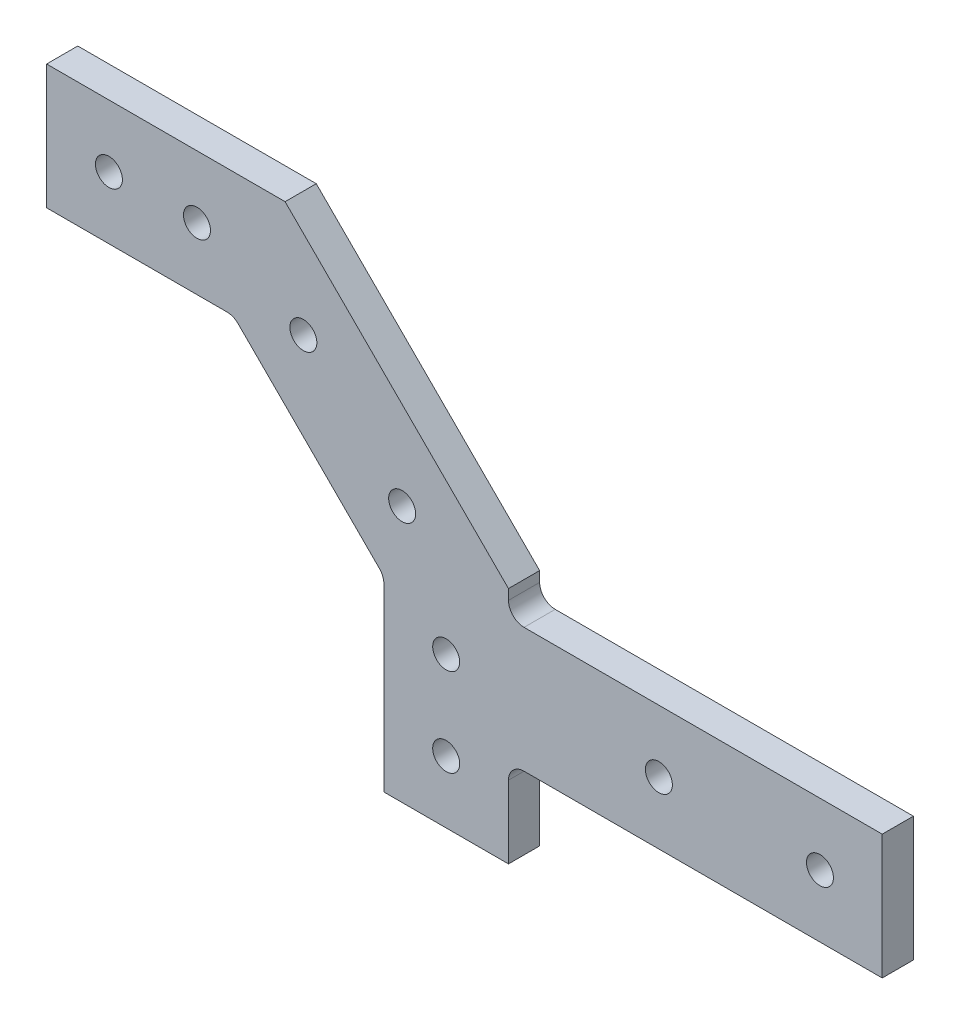
from build123d import *

# Parameters (mm, degrees)
BOSS_EXTRUDE1_DEPTH      = 6.35
FILLET1_R                = 3.175
M5_CLEARANCE_HOLE1_D     = 5.5
M5_CLEARANCE_HOLE1_DEPTH = 18.75
M5_CLEARANCE_HOLE1_TIP   = 1.652366702


with BuildPart() as part:
    # Sketch1 → Boss-Extrude1 (new body)
    with BuildSketch(Plane.XY):
        Polygon((0, 38.1), (0, 58.239487758), (-30.660512242, 88.9), (-68.760512242, 88.9), (-68.760512242, 114.3), (-20.139487758, 114.3), (25.4, 68.760512242), (25.4, 63.5), (101.6, 63.5), (101.6, 38.1), (25.4, 38.1), (25.4, 20.139487758), (0, 20.139487758), align=None)
    extrude(amount=BOSS_EXTRUDE1_DEPTH)

    # Fillet1
    fillet1_edges = [part.edges().sort_by_distance(p)[0] for p in [
        (-30.660512242, 88.9, 3.175),
        (0, 58.239487758, 3.175),
        (25.4, 63.5, 3.175),
        (25.4, 38.1, 3.175),
    ]]
    fillet(fillet1_edges, radius=FILLET1_R)

    # M5 Clearance Hole1
    with Locations(Plane.XY.offset(6.35)):
        with Locations((12.7, 50.8), (56.061204364, 50.8), (88.9, 50.8), (3.719743879, 72.480256121), (-16.419743879, 92.619743879), (-38.1, 101.6), (-56.060512242, 101.6), (12.7, 32.839487758)):
            Hole(M5_CLEARANCE_HOLE1_D / 2, depth=M5_CLEARANCE_HOLE1_DEPTH)
            with Locations((0, 0, -(M5_CLEARANCE_HOLE1_DEPTH + M5_CLEARANCE_HOLE1_TIP / 2))):  # 118° drill point
                Cone(0, M5_CLEARANCE_HOLE1_D / 2, M5_CLEARANCE_HOLE1_TIP, mode=Mode.SUBTRACT)


solid = part.part
